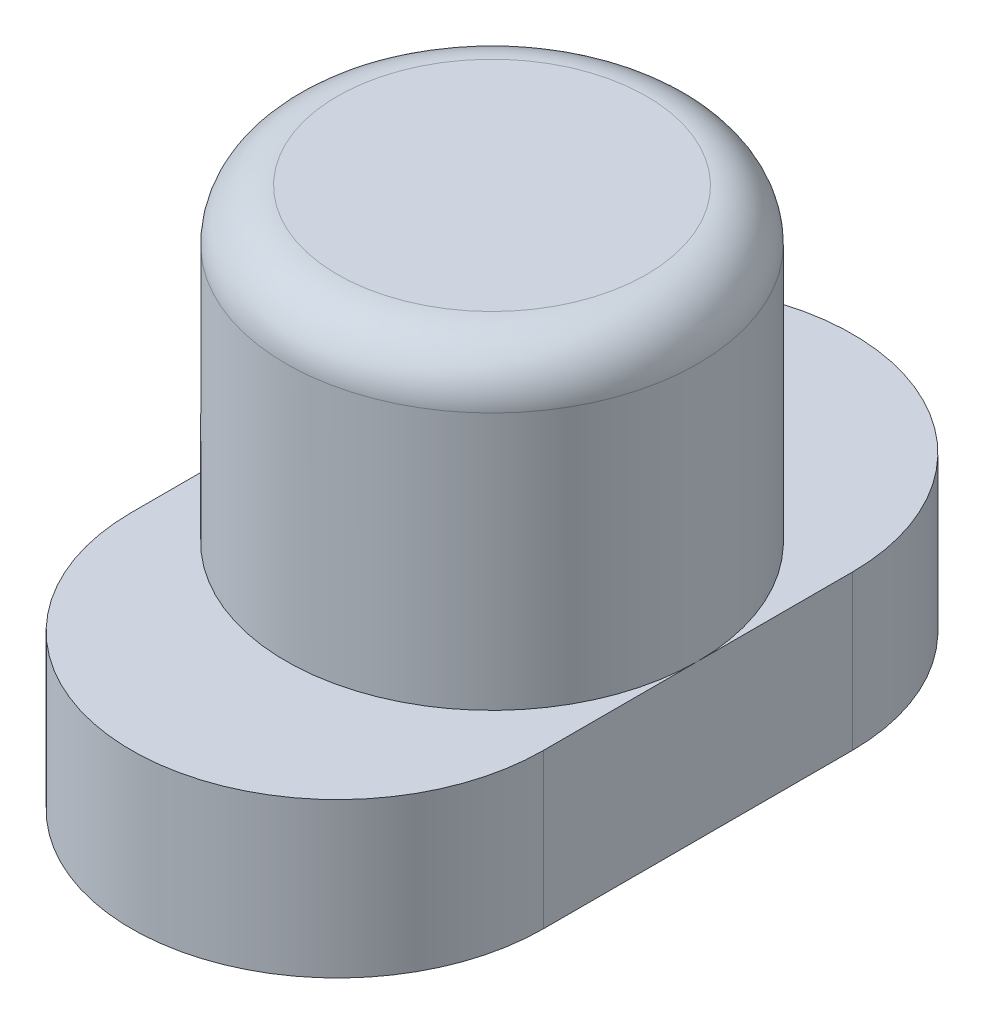
from build123d import *

# Parameters (mm, degrees)
SKETCH2_W          = 3.5
SKETCH2_H          = 2.5
CUT_EXTRUDE1_DEPTH = 3
CUT_EXTRUDE1_DRAFT = -8
FILLET1_R          = 1
CUT_EXTRUDE2_DEPTH = 14.37908816


with BuildPart() as part:
    # Sketch1 → Revolve1 (revolve)
    with BuildSketch(Plane.XY):
        Polygon((0, 9), (4, 9), (4, 3), (7, 3), (7, 0), (0, 0), align=None)
    revolve(axis=Axis((0, 9, 0), (0, -1, 0)))


with BuildPart() as cut_extrude1_tool:
    # Sketch2 → Cut-Extrude1 (with draft: the straight prism first)
    with BuildSketch(Plane.XZ):
        Rectangle(SKETCH2_W, SKETCH2_H)
    extrude(amount=-CUT_EXTRUDE1_DEPTH)
    # Cut-Extrude1: the draft: its side faces are tilted about the plane it starts from
    cut_extrude1_sides = [cut_extrude1_tool.faces().sort_by_distance(p)[0] for p in [
        (0, 1.5, -1.25),
        (1.75, 1.5, 0),
        (0, 1.5, 1.25),
        (-1.75, 1.5, 0),
    ]]
    draft(cut_extrude1_sides, Plane.XZ, CUT_EXTRUDE1_DRAFT)


with BuildPart() as part_1:
    add(part.part)

    # Cut-Extrude1: cut by cut_extrude1_tool
    add(cut_extrude1_tool.part, mode=Mode.SUBTRACT)

    # Fillet1
    fillet1_edges = [part_1.edges().sort_by_distance(p)[0] for p in [
        (-4, 9, 0),
    ]]
    fillet(fillet1_edges, radius=FILLET1_R)

    # Sketch3 → Cut-Extrude2 (cut, through all)
    with BuildSketch(Plane(origin=(0, 0, 0), x_dir=(1, 0, 0), z_dir=(0, 1, 0))):
        with BuildLine():
            Line((-14, -3), (-14, 3))
            ThreePointArc((-14, 3), (0, 17), (14, 3))
            Line((14, 3), (14, -3))
            ThreePointArc((14, -3), (0, -17), (-14, -3))
        make_face()
        with BuildLine():
            Line((-4, -3), (-4, 3))
            ThreePointArc((-4, 3), (0, 7), (4, 3))
            Line((4, 3), (4, -3))
            ThreePointArc((4, -3), (0, -7), (-4, -3))
        make_face(mode=Mode.SUBTRACT)
    extrude(amount=CUT_EXTRUDE2_DEPTH, mode=Mode.SUBTRACT)


solid = part_1.part
